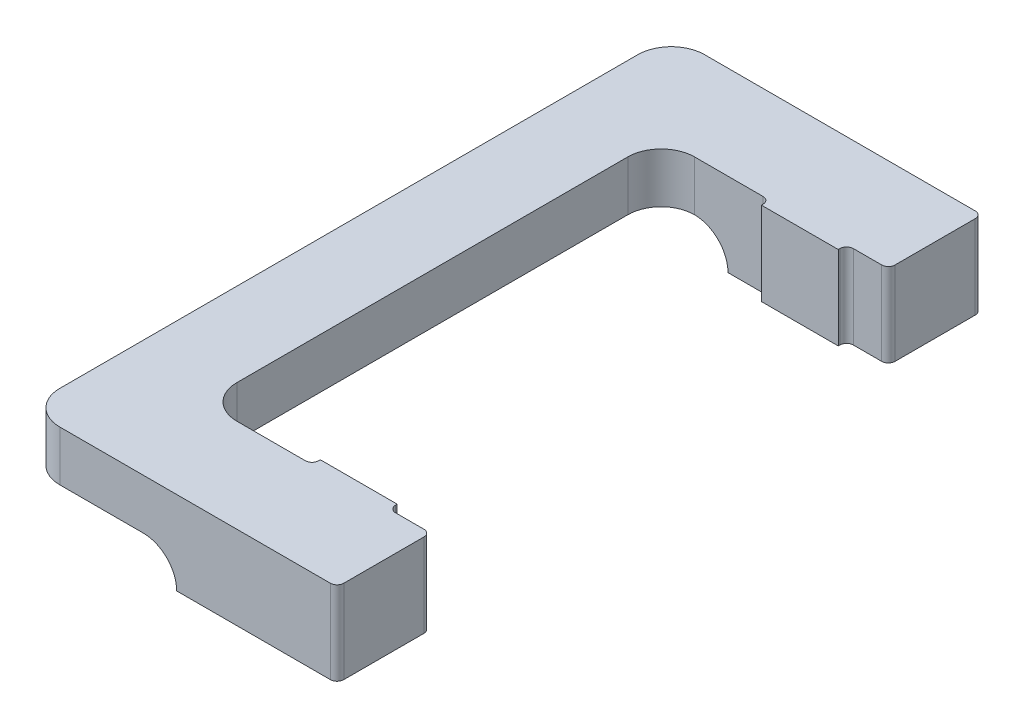
from build123d import *

# Parameters (mm, degrees)
EXTRUDE_1_DEPTH   = 5
EXTRUDE_1_2_DEPTH = 5
EXTRUDE_1_3_DEPTH = 3
SKETCH_3_W        = 8
SKETCH_3_H        = 4.5
EXTRUDE_2_DEPTH   = 1
FILLET_1_R        = 2
FILLET_2_R        = 0.4
FILLET_3_R        = 0.4


with BuildPart() as part:
    # Эскиз1 → Extrude 1 (new body)
    with BuildSketch(Plane(origin=(0, 0, 0), x_dir=(1, 0, 0), z_dir=(0, 1, 0))):
        Polygon((3.047071049, 14.786951222), (5.547071049, 14.786951222), (5.547071049, 20.386951222), (-4.052928951, 20.386951222), (-4.052928951, 14.786951222), (-1.552928951, 14.786951222), (-1.552928951, 14.286951222), (3.047071049, 14.286951222), align=None)
        Polygon((2.247071049, 15.586951222), (4.747071049, 15.586951222), (4.747071049, 19.586951222), (-3.252928951, 19.586951222), (-3.252928951, 15.586951222), (-0.752928951, 15.586951222), (-0.752928951, 15.086951222), (2.247071049, 15.086951222), align=None, mode=Mode.SUBTRACT)
    extrude(amount=EXTRUDE_1_DEPTH)



with BuildPart() as body_2:
    # Эскиз1 → Extrude 1 2 (new body)
    with BuildSketch(Plane(origin=(0, 0, 0), x_dir=(1, 0, 0), z_dir=(0, 1, 0))):
        Polygon((-4.052928951, -12.613048778), (-4.052928951, -18.213048778), (5.547071049, -18.213048778), (5.547071049, -12.613048778), (3.047071049, -12.613048778), (3.047071049, -12.113048778), (-1.552928951, -12.113048778), (-1.552928951, -12.613048778), align=None)
        Polygon((-3.252928951, -13.413048778), (-3.252928951, -17.413048778), (4.747071049, -17.413048778), (4.747071049, -13.413048778), (2.247071049, -13.413048778), (2.247071049, -12.913048778), (-0.752928951, -12.913048778), (-0.752928951, -13.413048778), align=None, mode=Mode.SUBTRACT)
    extrude(amount=EXTRUDE_1_2_DEPTH)


with BuildPart() as part_1:
    add(part.part)

    add(body_2.part)  # Extrude 1 3 merges body 2
    # Эскиз2 → Extrude 1 3 (add)
    with BuildSketch(Plane(origin=(0, 5, 0), x_dir=(1, 0, 0), z_dir=(0, 1, 0))):
        Polygon((-4.052928951, 20.386951222), (-13.052928951, 20.386951222), (-13.052928951, -18.213048778), (-4.052928951, -18.213048778), (-4.052928951, -12.613048778), (-8.052928951, -12.613048778), (-8.052928951, 14.786951222), (-4.052928951, 14.786951222), align=None)
    extrude(amount=-EXTRUDE_1_3_DEPTH)

    # Эскиз3 → Бобышка-Вытянуть2 (add)
    with BuildSketch(Plane(origin=(0, 5, 0), x_dir=(1, 0, 0), z_dir=(0, 1, 0))):
        with Locations((0.747071049, 17.336951222)):
            Rectangle(SKETCH_3_W, SKETCH_3_H)
        with Locations((0.747071049, -15.163048778)):
            Rectangle(SKETCH_3_W, SKETCH_3_H)
    extrude(amount=-EXTRUDE_2_DEPTH)

    # Скругление1
    fillet_1_edges = [part_1.edges().sort_by_distance(p)[0] for p in [
        (-4.052928951, 2, -17.586951222),
        (-4.052928951, 2, 15.413048778),
        (-8.052928951, 3.5, 12.613048778),
        (-8.052928951, 3.5, -14.786951222),
        (-13.052928951, 3.5, -20.386951222),
        (-13.052928951, 3.5, 18.213048778),
    ]]
    fillet(fillet_1_edges, radius=FILLET_1_R - 0.0001)  # a hair under: the kernel refuses the full size

    # Скругление2
    fillet_2_edges = [part_1.edges().sort_by_distance(p)[0] for p in [
        (5.547071049, 2.5, -14.786951222),
        (5.547071049, 2.5, -20.386951222),
        (5.547071049, 2.5, 18.213048778),
        (5.547071049, 2.5, 12.613048778),
    ]]
    fillet(fillet_2_edges, radius=FILLET_2_R)

    # Скругление3
    fillet_3_edges = [part_1.edges().sort_by_distance(p)[0] for p in [
        (-0.752928951, 2, -15.586951222),
        (3.047071049, 2.5, -14.786951222),
        (-1.552928951, 2.5, -14.786951222),
        (-0.752928951, 2, 13.413048778),
        (2.247071049, 2, 13.413048778),
        (3.047071049, 2.5, 12.613048778),
        (-1.552928951, 2.5, 12.613048778),
        (2.247071049, 2, -15.586951222),
    ]]
    fillet(fillet_3_edges, radius=FILLET_3_R)


solid = part_1.part
